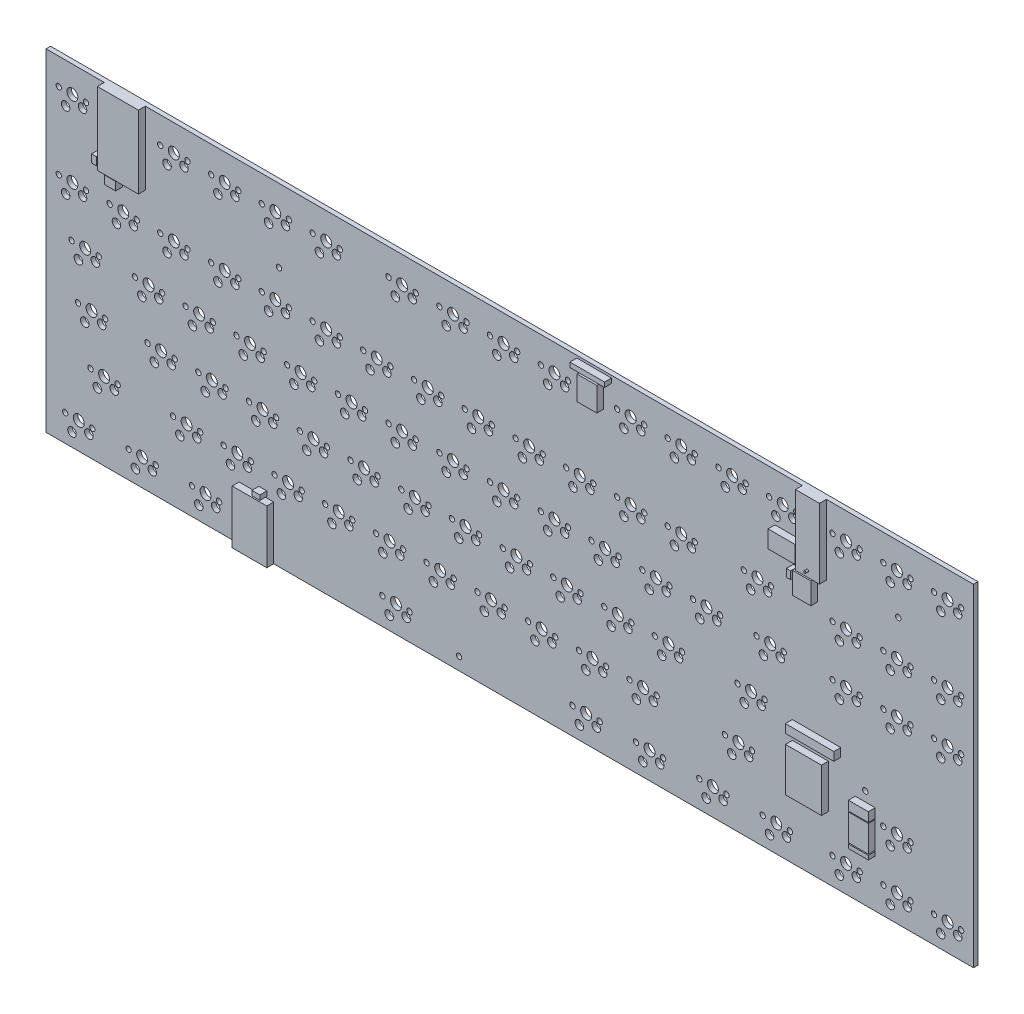
from build123d import *

# Parameters (mm, degrees)
SKETCH_1_W          = 348.235
SKETCH_1_H          = 124.714
EXTRUDE_1_DEPTH     = 1.7
SKETCH_3_R          = 1
CUT_EXTRUDE_1_DEPTH = 370.897400668
SKETCH_4_R          = 2.05
SKETCH_4_R_2        = 1.6
CUT_EXTRUDE_2_DEPTH = 370.897400668
SKETCH_5_R          = 2.05
SKETCH_5_R_2        = 1.6
SKETCH_5_R_3        = 1
CUT_EXTRUDE_3_DEPTH = 370.897400668
SKETCH_6_R          = 2.05
SKETCH_6_R_2        = 1.6
SKETCH_6_R_3        = 1
CUT_EXTRUDE_4_DEPTH = 370.897400668
SKETCH_8_R          = 2.05
SKETCH_8_R_2        = 1.6
SKETCH_8_R_3        = 1
CUT_EXTRUDE_5_DEPTH = 370.897400668
SKETCH_10_R         = 2.05
SKETCH_10_R_2       = 1.6
SKETCH_10_R_3       = 1
CUT_EXTRUDE_6_DEPTH = 370.897400668
SKETCH_11_R         = 1
CUT_EXTRUDE_7_DEPTH = 370.897400668
SKETCH_12_W         = 15.4
SKETCH_12_H         = 27.3
SKETCH_12_W_2       = 1.8
SKETCH_12_H_2       = 3
SKETCH_12_W_3       = 4.1
SKETCH_12_H_3       = 3.1
SKETCH_12_W_4       = 13
SKETCH_12_H_4       = 1.8
SKETCH_12_W_5       = 7.4
SKETCH_12_H_5       = 9
SKETCH_12_W_6       = 9
SKETCH_12_H_6       = 26.3
SKETCH_12_W_7       = 10.1
SKETCH_12_H_7       = 6.5
SKETCH_12_W_8       = 6.9
SKETCH_12_H_8       = 8.1
SKETCH_12_W_9       = 1.6
SKETCH_12_H_9       = 2.9
SKETCH_12_W_10      = 18.2
SKETCH_12_H_10      = 3.2
SKETCH_12_W_11      = 13.5
SKETCH_12_H_11      = 16.4
SKETCH_12_W_12      = 7.5
SKETCH_12_H_12      = 10
SKETCH_12_H_13      = 3.5
SKETCH_12_H_14      = 1.5
SKETCH_12_H_15      = 20.1
SKETCH_12_W_13      = 3
EXTRUDE_2_DEPTH     = 2.6
SKETCH_13_W         = 6.6
SKETCH_13_H         = 11.2
EXTRUDE_3_DEPTH     = 2
SKETCH_15_R         = 0.4
EXTRUDE_4_DEPTH     = 1


with BuildPart() as part:
    # 草图1 → 凸台-拉伸1 (new body)
    with BuildSketch(Plane.XY):
        with Locations((174.1175, -62.357)):
            Rectangle(SKETCH_1_W, SKETCH_1_H)
    extrude(amount=EXTRUDE_1_DEPTH)

    # 草图3 → 切除-拉伸1 (cut, through all)
    with BuildSketch(Plane.XY.offset(1.7)):
        with Locations((87.5, -27.4)):
            Circle(SKETCH_3_R)
        with Locations((155.1, -120)):
            Circle(SKETCH_3_R)
        with Locations((307.6, -87.5)):
            Circle(SKETCH_3_R)
        with Locations((320, -24.9)):
            Circle(SKETCH_3_R)
    extrude(amount=-CUT_EXTRUDE_1_DEPTH, mode=Mode.SUBTRACT)

    # 草图4 → 切除-拉伸2 (cut, through all)
    with BuildSketch(Plane.XY.offset(1.7)):
        with Locations((9.9, -9.9)):
            Circle(SKETCH_4_R)
        with Locations((7.36, -14.91)):
            Circle(SKETCH_4_R_2)
        with Locations((13.71, -12.44)):
            Circle(SKETCH_4_R_2)
        with Locations((9.9, -38.5)):
            Circle(SKETCH_4_R)
        with Locations((7.36, -43.51)):
            Circle(SKETCH_4_R_2)
        with Locations((13.71, -41.04)):
            Circle(SKETCH_4_R_2)
        with Locations((14.7, -57.5)):
            Circle(SKETCH_4_R)
        with Locations((12.16, -62.51)):
            Circle(SKETCH_4_R_2)
        with Locations((18.51, -60.04)):
            Circle(SKETCH_4_R_2)
        with Locations((17.1, -76.6)):
            Circle(SKETCH_4_R)
        with Locations((14.56, -81.61)):
            Circle(SKETCH_4_R_2)
        with Locations((20.91, -79.14)):
            Circle(SKETCH_4_R_2)
        with Locations((21.8, -95.6)):
            Circle(SKETCH_4_R)
        with Locations((19.26, -100.61)):
            Circle(SKETCH_4_R_2)
        with Locations((25.61, -98.14)):
            Circle(SKETCH_4_R_2)
        with Locations((12.3, -114.7)):
            Circle(SKETCH_4_R)
        with Locations((9.76, -119.71)):
            Circle(SKETCH_4_R_2)
        with Locations((16.11, -117.24)):
            Circle(SKETCH_4_R_2)
        with Locations((48, -9.9)):
            Circle(SKETCH_4_R)
        with Locations((45.46, -14.91)):
            Circle(SKETCH_4_R_2)
        with Locations((51.81, -12.44)):
            Circle(SKETCH_4_R_2)
        with Locations((105.2, -9.9)):
            Circle(SKETCH_4_R)
        with Locations((102.66, -14.91)):
            Circle(SKETCH_4_R_2)
        with Locations((109.01, -12.44)):
            Circle(SKETCH_4_R_2)
        with Locations((133.7, -9.9)):
            Circle(SKETCH_4_R)
        with Locations((131.16, -14.91)):
            Circle(SKETCH_4_R_2)
        with Locations((137.51, -12.44)):
            Circle(SKETCH_4_R_2)
        with Locations((190.9, -9.9)):
            Circle(SKETCH_4_R)
        with Locations((188.36, -14.91)):
            Circle(SKETCH_4_R_2)
        with Locations((194.71, -12.44)):
            Circle(SKETCH_4_R_2)
        with Locations((219.5, -9.9)):
            Circle(SKETCH_4_R)
        with Locations((216.96, -14.91)):
            Circle(SKETCH_4_R_2)
        with Locations((223.31, -12.44)):
            Circle(SKETCH_4_R_2)
        with Locations((276.6, -9.9)):
            Circle(SKETCH_4_R)
        with Locations((274.06, -14.91)):
            Circle(SKETCH_4_R_2)
        with Locations((280.41, -12.44)):
            Circle(SKETCH_4_R_2)
        with Locations((300.4, -9.9)):
            Circle(SKETCH_4_R)
        with Locations((297.86, -14.91)):
            Circle(SKETCH_4_R_2)
        with Locations((304.21, -12.44)):
            Circle(SKETCH_4_R_2)
        with Locations((338.5, -9.9)):
            Circle(SKETCH_4_R)
        with Locations((335.96, -14.91)):
            Circle(SKETCH_4_R_2)
        with Locations((342.31, -12.44)):
            Circle(SKETCH_4_R_2)
        with Locations((260, -95.6)):
            Circle(SKETCH_4_R)
        with Locations((257.46, -100.61)):
            Circle(SKETCH_4_R_2)
        with Locations((263.81, -98.14)):
            Circle(SKETCH_4_R_2)
        with Locations((264.7, -76.6)):
            Circle(SKETCH_4_R)
        with Locations((262.16, -81.61)):
            Circle(SKETCH_4_R_2)
        with Locations((268.51, -79.14)):
            Circle(SKETCH_4_R_2)
        with Locations((271.9, -57.5)):
            Circle(SKETCH_4_R)
        with Locations((269.36, -62.51)):
            Circle(SKETCH_4_R_2)
        with Locations((275.71, -60.04)):
            Circle(SKETCH_4_R_2)
        with Locations((267.1, -38.5)):
            Circle(SKETCH_4_R)
        with Locations((264.56, -43.51)):
            Circle(SKETCH_4_R_2)
        with Locations((270.91, -41.04)):
            Circle(SKETCH_4_R_2)
        with Locations((274.2, -114.7)):
            Circle(SKETCH_4_R)
        with Locations((271.66, -119.71)):
            Circle(SKETCH_4_R_2)
        with Locations((278.01, -117.24)):
            Circle(SKETCH_4_R_2)
        with Locations((300.4, -38.5)):
            Circle(SKETCH_4_R)
        with Locations((297.86, -43.51)):
            Circle(SKETCH_4_R_2)
        with Locations((304.21, -41.04)):
            Circle(SKETCH_4_R_2)
        with Locations((338.5, -38.5)):
            Circle(SKETCH_4_R)
        with Locations((335.96, -43.51)):
            Circle(SKETCH_4_R_2)
        with Locations((342.31, -41.04)):
            Circle(SKETCH_4_R_2)
        with Locations((300.4, -57.5)):
            Circle(SKETCH_4_R)
        with Locations((297.86, -62.51)):
            Circle(SKETCH_4_R_2)
        with Locations((304.21, -60.04)):
            Circle(SKETCH_4_R_2)
        with Locations((338.5, -57.5)):
            Circle(SKETCH_4_R)
        with Locations((335.96, -62.51)):
            Circle(SKETCH_4_R_2)
        with Locations((342.31, -60.04)):
            Circle(SKETCH_4_R_2)
        with Locations((300.4, -114.7)):
            Circle(SKETCH_4_R)
        with Locations((297.86, -119.71)):
            Circle(SKETCH_4_R_2)
        with Locations((304.21, -117.24)):
            Circle(SKETCH_4_R_2)
        with Locations((319.5, -114.7)):
            Circle(SKETCH_4_R)
        with Locations((316.96, -119.71)):
            Circle(SKETCH_4_R_2)
        with Locations((323.31, -117.24)):
            Circle(SKETCH_4_R_2)
        with Locations((338.5, -114.7)):
            Circle(SKETCH_4_R)
        with Locations((335.96, -119.71)):
            Circle(SKETCH_4_R_2)
        with Locations((342.31, -117.24)):
            Circle(SKETCH_4_R_2)
        with Locations((319.5, -95.6)):
            Circle(SKETCH_4_R)
        with Locations((316.96, -100.61)):
            Circle(SKETCH_4_R_2)
        with Locations((323.31, -98.14)):
            Circle(SKETCH_4_R_2)
        with Locations((319.5, -57.5)):
            Circle(SKETCH_4_R)
        with Locations((316.96, -62.51)):
            Circle(SKETCH_4_R_2)
        with Locations((323.31, -60.04)):
            Circle(SKETCH_4_R_2)
        with Locations((319.5, -38.5)):
            Circle(SKETCH_4_R)
        with Locations((316.96, -43.51)):
            Circle(SKETCH_4_R_2)
        with Locations((323.31, -41.04)):
            Circle(SKETCH_4_R_2)
        with Locations((319.5, -9.9)):
            Circle(SKETCH_4_R)
        with Locations((316.96, -14.91)):
            Circle(SKETCH_4_R_2)
        with Locations((323.31, -12.44)):
            Circle(SKETCH_4_R_2)
        with Locations((131.4, -114.7)):
            Circle(SKETCH_4_R)
        with Locations((128.86, -119.71)):
            Circle(SKETCH_4_R_2)
        with Locations((135.21, -117.24)):
            Circle(SKETCH_4_R_2)
        with Locations((67.1, -9.9)):
            Circle(SKETCH_4_R)
        with Locations((64.56, -14.91)):
            Circle(SKETCH_4_R_2)
        with Locations((70.91, -12.44)):
            Circle(SKETCH_4_R_2)
        with Locations((86.1, -9.9)):
            Circle(SKETCH_4_R)
        with Locations((83.56, -14.91)):
            Circle(SKETCH_4_R_2)
        with Locations((89.91, -12.44)):
            Circle(SKETCH_4_R_2)
        with Locations((152.8, -9.9)):
            Circle(SKETCH_4_R)
        with Locations((150.26, -14.91)):
            Circle(SKETCH_4_R_2)
        with Locations((156.61, -12.44)):
            Circle(SKETCH_4_R_2)
        with Locations((171.8, -9.9)):
            Circle(SKETCH_4_R)
        with Locations((169.26, -14.91)):
            Circle(SKETCH_4_R_2)
        with Locations((175.61, -12.44)):
            Circle(SKETCH_4_R_2)
        with Locations((238.5, -9.9)):
            Circle(SKETCH_4_R)
        with Locations((235.96, -14.91)):
            Circle(SKETCH_4_R_2)
        with Locations((242.31, -12.44)):
            Circle(SKETCH_4_R_2)
        with Locations((257.6, -9.9)):
            Circle(SKETCH_4_R)
        with Locations((255.06, -14.91)):
            Circle(SKETCH_4_R_2)
        with Locations((261.41, -12.44)):
            Circle(SKETCH_4_R_2)
    extrude(amount=-CUT_EXTRUDE_2_DEPTH, mode=Mode.SUBTRACT)

    # 草图5 → 切除-拉伸3 (cut, through all)
    with BuildSketch(Plane.XY.offset(1.7)):
        with Locations((29, -38.5)):
            Circle(SKETCH_5_R)
        with Locations((26.46, -43.51)):
            Circle(SKETCH_5_R_2)
        with Locations((32.81, -41.04)):
            Circle(SKETCH_5_R_2)
        with Locations((48, -38.5)):
            Circle(SKETCH_5_R)
        with Locations((45.46, -43.51)):
            Circle(SKETCH_5_R_2)
        with Locations((51.81, -41.04)):
            Circle(SKETCH_5_R_2)
        with Locations((67.1, -38.5)):
            Circle(SKETCH_5_R)
        with Locations((64.56, -43.51)):
            Circle(SKETCH_5_R_2)
        with Locations((70.91, -41.04)):
            Circle(SKETCH_5_R_2)
        with Locations((86.1, -38.5)):
            Circle(SKETCH_5_R)
        with Locations((83.56, -43.51)):
            Circle(SKETCH_5_R_2)
        with Locations((89.91, -41.04)):
            Circle(SKETCH_5_R_2)
        with Locations((105.2, -38.5)):
            Circle(SKETCH_5_R)
        with Locations((102.66, -43.51)):
            Circle(SKETCH_5_R_2)
        with Locations((109.01, -41.04)):
            Circle(SKETCH_5_R_2)
        with Locations((124.2, -38.5)):
            Circle(SKETCH_5_R)
        with Locations((121.66, -43.51)):
            Circle(SKETCH_5_R_2)
        with Locations((128.01, -41.04)):
            Circle(SKETCH_5_R_2)
        with Locations((143.3, -38.5)):
            Circle(SKETCH_5_R)
        with Locations((140.76, -43.51)):
            Circle(SKETCH_5_R_2)
        with Locations((147.11, -41.04)):
            Circle(SKETCH_5_R_2)
        with Locations((162.3, -38.5)):
            Circle(SKETCH_5_R)
        with Locations((159.76, -43.51)):
            Circle(SKETCH_5_R_2)
        with Locations((166.11, -41.04)):
            Circle(SKETCH_5_R_2)
        with Locations((181.4, -38.5)):
            Circle(SKETCH_5_R)
        with Locations((178.86, -43.51)):
            Circle(SKETCH_5_R_2)
        with Locations((185.21, -41.04)):
            Circle(SKETCH_5_R_2)
        with Locations((200.4, -38.5)):
            Circle(SKETCH_5_R)
        with Locations((197.86, -43.51)):
            Circle(SKETCH_5_R_2)
        with Locations((204.21, -41.04)):
            Circle(SKETCH_5_R_2)
        with Locations((219.5, -38.5)):
            Circle(SKETCH_5_R)
        with Locations((216.96, -43.51)):
            Circle(SKETCH_5_R_2)
        with Locations((223.31, -41.04)):
            Circle(SKETCH_5_R_2)
        with Locations((238.5, -38.5)):
            Circle(SKETCH_5_R)
        with Locations((235.96, -43.51)):
            Circle(SKETCH_5_R_2)
        with Locations((242.31, -41.04)):
            Circle(SKETCH_5_R_2)
        with Locations((23.9, -38.5)):
            Circle(SKETCH_5_R_3)
        with Locations((34.1, -38.5)):
            Circle(SKETCH_5_R_3)
        with Locations((42.9, -38.5)):
            Circle(SKETCH_5_R_3)
        with Locations((53.1, -38.5)):
            Circle(SKETCH_5_R_3)
        with Locations((62, -38.5)):
            Circle(SKETCH_5_R_3)
        with Locations((72.2, -38.5)):
            Circle(SKETCH_5_R_3)
        with Locations((81, -38.5)):
            Circle(SKETCH_5_R_3)
        with Locations((91.2, -38.5)):
            Circle(SKETCH_5_R_3)
        with Locations((100.1, -38.5)):
            Circle(SKETCH_5_R_3)
        with Locations((110.3, -38.5)):
            Circle(SKETCH_5_R_3)
        with Locations((119.1, -38.5)):
            Circle(SKETCH_5_R_3)
        with Locations((129.3, -38.5)):
            Circle(SKETCH_5_R_3)
        with Locations((138.2, -38.5)):
            Circle(SKETCH_5_R_3)
        with Locations((148.4, -38.5)):
            Circle(SKETCH_5_R_3)
        with Locations((157.2, -38.5)):
            Circle(SKETCH_5_R_3)
        with Locations((167.4, -38.5)):
            Circle(SKETCH_5_R_3)
        with Locations((176.3, -38.5)):
            Circle(SKETCH_5_R_3)
        with Locations((186.5, -38.5)):
            Circle(SKETCH_5_R_3)
        with Locations((195.3, -38.5)):
            Circle(SKETCH_5_R_3)
        with Locations((205.5, -38.5)):
            Circle(SKETCH_5_R_3)
        with Locations((214.4, -38.5)):
            Circle(SKETCH_5_R_3)
        with Locations((224.6, -38.5)):
            Circle(SKETCH_5_R_3)
        with Locations((233.4, -38.5)):
            Circle(SKETCH_5_R_3)
        with Locations((243.6, -38.5)):
            Circle(SKETCH_5_R_3)
    extrude(amount=-CUT_EXTRUDE_3_DEPTH, mode=Mode.SUBTRACT)

    # 草图6 → 切除-拉伸4 (cut, through all)
    with BuildSketch(Plane.XY.offset(1.7)):
        with Locations((38.5, -57.5)):
            Circle(SKETCH_6_R)
        with Locations((35.96, -62.51)):
            Circle(SKETCH_6_R_2)
        with Locations((42.31, -60.04)):
            Circle(SKETCH_6_R_2)
        with Locations((33.4, -57.5)):
            Circle(SKETCH_6_R_3)
        with Locations((43.6, -57.5)):
            Circle(SKETCH_6_R_3)
        with Locations((57.5, -57.5)):
            Circle(SKETCH_6_R)
        with Locations((54.96, -62.51)):
            Circle(SKETCH_6_R_2)
        with Locations((61.31, -60.04)):
            Circle(SKETCH_6_R_2)
        with Locations((52.4, -57.5)):
            Circle(SKETCH_6_R_3)
        with Locations((62.6, -57.5)):
            Circle(SKETCH_6_R_3)
        with Locations((76.6, -57.5)):
            Circle(SKETCH_6_R)
        with Locations((74.06, -62.51)):
            Circle(SKETCH_6_R_2)
        with Locations((80.41, -60.04)):
            Circle(SKETCH_6_R_2)
        with Locations((71.5, -57.5)):
            Circle(SKETCH_6_R_3)
        with Locations((81.7, -57.5)):
            Circle(SKETCH_6_R_3)
        with Locations((95.6, -57.5)):
            Circle(SKETCH_6_R)
        with Locations((93.06, -62.51)):
            Circle(SKETCH_6_R_2)
        with Locations((99.41, -60.04)):
            Circle(SKETCH_6_R_2)
        with Locations((90.5, -57.5)):
            Circle(SKETCH_6_R_3)
        with Locations((100.7, -57.5)):
            Circle(SKETCH_6_R_3)
        with Locations((114.7, -57.5)):
            Circle(SKETCH_6_R)
        with Locations((112.16, -62.51)):
            Circle(SKETCH_6_R_2)
        with Locations((118.51, -60.04)):
            Circle(SKETCH_6_R_2)
        with Locations((109.6, -57.5)):
            Circle(SKETCH_6_R_3)
        with Locations((119.8, -57.5)):
            Circle(SKETCH_6_R_3)
        with Locations((133.7, -57.5)):
            Circle(SKETCH_6_R)
        with Locations((131.16, -62.51)):
            Circle(SKETCH_6_R_2)
        with Locations((137.51, -60.04)):
            Circle(SKETCH_6_R_2)
        with Locations((128.6, -57.5)):
            Circle(SKETCH_6_R_3)
        with Locations((138.8, -57.5)):
            Circle(SKETCH_6_R_3)
        with Locations((152.8, -57.5)):
            Circle(SKETCH_6_R)
        with Locations((150.26, -62.51)):
            Circle(SKETCH_6_R_2)
        with Locations((156.61, -60.04)):
            Circle(SKETCH_6_R_2)
        with Locations((147.7, -57.5)):
            Circle(SKETCH_6_R_3)
        with Locations((157.9, -57.5)):
            Circle(SKETCH_6_R_3)
        with Locations((171.8, -57.5)):
            Circle(SKETCH_6_R)
        with Locations((169.26, -62.51)):
            Circle(SKETCH_6_R_2)
        with Locations((175.61, -60.04)):
            Circle(SKETCH_6_R_2)
        with Locations((166.7, -57.5)):
            Circle(SKETCH_6_R_3)
        with Locations((176.9, -57.5)):
            Circle(SKETCH_6_R_3)
        with Locations((190.9, -57.5)):
            Circle(SKETCH_6_R)
        with Locations((188.36, -62.51)):
            Circle(SKETCH_6_R_2)
        with Locations((194.71, -60.04)):
            Circle(SKETCH_6_R_2)
        with Locations((185.8, -57.5)):
            Circle(SKETCH_6_R_3)
        with Locations((196, -57.5)):
            Circle(SKETCH_6_R_3)
        with Locations((209.9, -57.5)):
            Circle(SKETCH_6_R)
        with Locations((207.36, -62.51)):
            Circle(SKETCH_6_R_2)
        with Locations((213.71, -60.04)):
            Circle(SKETCH_6_R_2)
        with Locations((204.8, -57.5)):
            Circle(SKETCH_6_R_3)
        with Locations((215, -57.5)):
            Circle(SKETCH_6_R_3)
        with Locations((229, -57.5)):
            Circle(SKETCH_6_R)
        with Locations((226.46, -62.51)):
            Circle(SKETCH_6_R_2)
        with Locations((232.81, -60.04)):
            Circle(SKETCH_6_R_2)
        with Locations((223.9, -57.5)):
            Circle(SKETCH_6_R_3)
        with Locations((234.1, -57.5)):
            Circle(SKETCH_6_R_3)
        with Locations((248, -57.5)):
            Circle(SKETCH_6_R)
        with Locations((245.46, -62.51)):
            Circle(SKETCH_6_R_2)
        with Locations((251.81, -60.04)):
            Circle(SKETCH_6_R_2)
        with Locations((242.9, -57.5)):
            Circle(SKETCH_6_R_3)
        with Locations((253.1, -57.5)):
            Circle(SKETCH_6_R_3)
    extrude(amount=-CUT_EXTRUDE_4_DEPTH, mode=Mode.SUBTRACT)

    # 草图8 → 切除-拉伸5 (cut, through all)
    with BuildSketch(Plane.XY.offset(1.7)):
        with Locations((43.2, -76.6)):
            Circle(SKETCH_8_R)
        with Locations((40.66, -81.61)):
            Circle(SKETCH_8_R_2)
        with Locations((47.01, -79.14)):
            Circle(SKETCH_8_R_2)
        with Locations((38.1, -76.6)):
            Circle(SKETCH_8_R_3)
        with Locations((48.3, -76.6)):
            Circle(SKETCH_8_R_3)
        with Locations((62.3, -76.6)):
            Circle(SKETCH_8_R)
        with Locations((59.76, -81.61)):
            Circle(SKETCH_8_R_2)
        with Locations((66.11, -79.14)):
            Circle(SKETCH_8_R_2)
        with Locations((57.2, -76.6)):
            Circle(SKETCH_8_R_3)
        with Locations((67.4, -76.6)):
            Circle(SKETCH_8_R_3)
        with Locations((81.3, -76.6)):
            Circle(SKETCH_8_R)
        with Locations((78.76, -81.61)):
            Circle(SKETCH_8_R_2)
        with Locations((85.11, -79.14)):
            Circle(SKETCH_8_R_2)
        with Locations((76.2, -76.6)):
            Circle(SKETCH_8_R_3)
        with Locations((86.4, -76.6)):
            Circle(SKETCH_8_R_3)
        with Locations((100.4, -76.6)):
            Circle(SKETCH_8_R)
        with Locations((97.86, -81.61)):
            Circle(SKETCH_8_R_2)
        with Locations((104.21, -79.14)):
            Circle(SKETCH_8_R_2)
        with Locations((95.3, -76.6)):
            Circle(SKETCH_8_R_3)
        with Locations((105.5, -76.6)):
            Circle(SKETCH_8_R_3)
        with Locations((119.4, -76.6)):
            Circle(SKETCH_8_R)
        with Locations((116.86, -81.61)):
            Circle(SKETCH_8_R_2)
        with Locations((123.21, -79.14)):
            Circle(SKETCH_8_R_2)
        with Locations((114.3, -76.6)):
            Circle(SKETCH_8_R_3)
        with Locations((124.5, -76.6)):
            Circle(SKETCH_8_R_3)
        with Locations((138.5, -76.6)):
            Circle(SKETCH_8_R)
        with Locations((135.96, -81.61)):
            Circle(SKETCH_8_R_2)
        with Locations((142.31, -79.14)):
            Circle(SKETCH_8_R_2)
        with Locations((133.4, -76.6)):
            Circle(SKETCH_8_R_3)
        with Locations((143.6, -76.6)):
            Circle(SKETCH_8_R_3)
        with Locations((157.5, -76.6)):
            Circle(SKETCH_8_R)
        with Locations((154.96, -81.61)):
            Circle(SKETCH_8_R_2)
        with Locations((161.31, -79.14)):
            Circle(SKETCH_8_R_2)
        with Locations((152.4, -76.6)):
            Circle(SKETCH_8_R_3)
        with Locations((162.6, -76.6)):
            Circle(SKETCH_8_R_3)
        with Locations((176.6, -76.6)):
            Circle(SKETCH_8_R)
        with Locations((174.06, -81.61)):
            Circle(SKETCH_8_R_2)
        with Locations((180.41, -79.14)):
            Circle(SKETCH_8_R_2)
        with Locations((171.5, -76.6)):
            Circle(SKETCH_8_R_3)
        with Locations((181.7, -76.6)):
            Circle(SKETCH_8_R_3)
        with Locations((195.6, -76.6)):
            Circle(SKETCH_8_R)
        with Locations((193.06, -81.61)):
            Circle(SKETCH_8_R_2)
        with Locations((199.41, -79.14)):
            Circle(SKETCH_8_R_2)
        with Locations((190.5, -76.6)):
            Circle(SKETCH_8_R_3)
        with Locations((200.7, -76.6)):
            Circle(SKETCH_8_R_3)
        with Locations((214.7, -76.6)):
            Circle(SKETCH_8_R)
        with Locations((212.16, -81.61)):
            Circle(SKETCH_8_R_2)
        with Locations((218.51, -79.14)):
            Circle(SKETCH_8_R_2)
        with Locations((209.6, -76.6)):
            Circle(SKETCH_8_R_3)
        with Locations((219.8, -76.6)):
            Circle(SKETCH_8_R_3)
        with Locations((233.7, -76.6)):
            Circle(SKETCH_8_R)
        with Locations((231.16, -81.61)):
            Circle(SKETCH_8_R_2)
        with Locations((237.51, -79.14)):
            Circle(SKETCH_8_R_2)
        with Locations((228.6, -76.6)):
            Circle(SKETCH_8_R_3)
        with Locations((238.8, -76.6)):
            Circle(SKETCH_8_R_3)
    extrude(amount=-CUT_EXTRUDE_5_DEPTH, mode=Mode.SUBTRACT)

    # 草图10 → 切除-拉伸6 (cut, through all)
    with BuildSketch(Plane.XY.offset(1.7)):
        with Locations((52.8, -95.6)):
            Circle(SKETCH_10_R)
        with Locations((50.26, -100.61)):
            Circle(SKETCH_10_R_2)
        with Locations((56.61, -98.14)):
            Circle(SKETCH_10_R_2)
        with Locations((47.7, -95.6)):
            Circle(SKETCH_10_R_3)
        with Locations((57.9, -95.6)):
            Circle(SKETCH_10_R_3)
        with Locations((71.8, -95.6)):
            Circle(SKETCH_10_R)
        with Locations((69.26, -100.61)):
            Circle(SKETCH_10_R_2)
        with Locations((75.61, -98.14)):
            Circle(SKETCH_10_R_2)
        with Locations((66.7, -95.6)):
            Circle(SKETCH_10_R_3)
        with Locations((76.9, -95.6)):
            Circle(SKETCH_10_R_3)
        with Locations((90.9, -95.6)):
            Circle(SKETCH_10_R)
        with Locations((88.36, -100.61)):
            Circle(SKETCH_10_R_2)
        with Locations((94.71, -98.14)):
            Circle(SKETCH_10_R_2)
        with Locations((85.8, -95.6)):
            Circle(SKETCH_10_R_3)
        with Locations((96, -95.6)):
            Circle(SKETCH_10_R_3)
        with Locations((109.9, -95.6)):
            Circle(SKETCH_10_R)
        with Locations((107.36, -100.61)):
            Circle(SKETCH_10_R_2)
        with Locations((113.71, -98.14)):
            Circle(SKETCH_10_R_2)
        with Locations((104.8, -95.6)):
            Circle(SKETCH_10_R_3)
        with Locations((115, -95.6)):
            Circle(SKETCH_10_R_3)
        with Locations((129, -95.6)):
            Circle(SKETCH_10_R)
        with Locations((126.46, -100.61)):
            Circle(SKETCH_10_R_2)
        with Locations((132.81, -98.14)):
            Circle(SKETCH_10_R_2)
        with Locations((123.9, -95.6)):
            Circle(SKETCH_10_R_3)
        with Locations((134.1, -95.6)):
            Circle(SKETCH_10_R_3)
        with Locations((148, -95.6)):
            Circle(SKETCH_10_R)
        with Locations((145.46, -100.61)):
            Circle(SKETCH_10_R_2)
        with Locations((151.81, -98.14)):
            Circle(SKETCH_10_R_2)
        with Locations((142.9, -95.6)):
            Circle(SKETCH_10_R_3)
        with Locations((153.1, -95.6)):
            Circle(SKETCH_10_R_3)
        with Locations((167.1, -95.6)):
            Circle(SKETCH_10_R)
        with Locations((164.56, -100.61)):
            Circle(SKETCH_10_R_2)
        with Locations((170.91, -98.14)):
            Circle(SKETCH_10_R_2)
        with Locations((162, -95.6)):
            Circle(SKETCH_10_R_3)
        with Locations((172.2, -95.6)):
            Circle(SKETCH_10_R_3)
        with Locations((186.1, -95.6)):
            Circle(SKETCH_10_R)
        with Locations((183.56, -100.61)):
            Circle(SKETCH_10_R_2)
        with Locations((189.91, -98.14)):
            Circle(SKETCH_10_R_2)
        with Locations((181, -95.6)):
            Circle(SKETCH_10_R_3)
        with Locations((191.2, -95.6)):
            Circle(SKETCH_10_R_3)
        with Locations((205.2, -95.6)):
            Circle(SKETCH_10_R)
        with Locations((202.66, -100.61)):
            Circle(SKETCH_10_R_2)
        with Locations((209.01, -98.14)):
            Circle(SKETCH_10_R_2)
        with Locations((200.1, -95.6)):
            Circle(SKETCH_10_R_3)
        with Locations((210.3, -95.6)):
            Circle(SKETCH_10_R_3)
        with Locations((224.2, -95.6)):
            Circle(SKETCH_10_R)
        with Locations((221.66, -100.61)):
            Circle(SKETCH_10_R_2)
        with Locations((228.01, -98.14)):
            Circle(SKETCH_10_R_2)
        with Locations((219.1, -95.6)):
            Circle(SKETCH_10_R_3)
        with Locations((229.3, -95.6)):
            Circle(SKETCH_10_R_3)
        with Locations((36.1, -114.7)):
            Circle(SKETCH_10_R)
        with Locations((33.56, -119.71)):
            Circle(SKETCH_10_R_2)
        with Locations((39.91, -117.24)):
            Circle(SKETCH_10_R_2)
        with Locations((31, -114.7)):
            Circle(SKETCH_10_R_3)
        with Locations((41.2, -114.7)):
            Circle(SKETCH_10_R_3)
        with Locations((59.9, -114.7)):
            Circle(SKETCH_10_R)
        with Locations((57.36, -119.71)):
            Circle(SKETCH_10_R_2)
        with Locations((63.71, -117.24)):
            Circle(SKETCH_10_R_2)
        with Locations((54.8, -114.7)):
            Circle(SKETCH_10_R_3)
        with Locations((65, -114.7)):
            Circle(SKETCH_10_R_3)
        with Locations((202.8, -114.7)):
            Circle(SKETCH_10_R)
        with Locations((200.26, -119.71)):
            Circle(SKETCH_10_R_2)
        with Locations((206.61, -117.24)):
            Circle(SKETCH_10_R_2)
        with Locations((197.7, -114.7)):
            Circle(SKETCH_10_R_3)
        with Locations((207.9, -114.7)):
            Circle(SKETCH_10_R_3)
        with Locations((226.6, -114.7)):
            Circle(SKETCH_10_R)
        with Locations((224.06, -119.71)):
            Circle(SKETCH_10_R_2)
        with Locations((230.41, -117.24)):
            Circle(SKETCH_10_R_2)
        with Locations((221.5, -114.7)):
            Circle(SKETCH_10_R_3)
        with Locations((231.7, -114.7)):
            Circle(SKETCH_10_R_3)
        with Locations((250.4, -114.7)):
            Circle(SKETCH_10_R)
        with Locations((247.86, -119.71)):
            Circle(SKETCH_10_R_2)
        with Locations((254.21, -117.24)):
            Circle(SKETCH_10_R_2)
        with Locations((245.3, -114.7)):
            Circle(SKETCH_10_R_3)
        with Locations((255.5, -114.7)):
            Circle(SKETCH_10_R_3)
    extrude(amount=-CUT_EXTRUDE_6_DEPTH, mode=Mode.SUBTRACT)

    # 草图11 → 切除-拉伸7 (cut, through all)
    with BuildSketch(Plane.XY.offset(1.7)):
        with Locations((4.8, -9.9)):
            Circle(SKETCH_11_R)
        with Locations((15, -9.9)):
            Circle(SKETCH_11_R)
        with Locations((42.9, -9.9)):
            Circle(SKETCH_11_R)
        with Locations((53.1, -9.9)):
            Circle(SKETCH_11_R)
        with Locations((62, -9.9)):
            Circle(SKETCH_11_R)
        with Locations((72.2, -9.9)):
            Circle(SKETCH_11_R)
        with Locations((81, -9.9)):
            Circle(SKETCH_11_R)
        with Locations((91.2, -9.9)):
            Circle(SKETCH_11_R)
        with Locations((100.1, -9.9)):
            Circle(SKETCH_11_R)
        with Locations((110.3, -9.9)):
            Circle(SKETCH_11_R)
        with Locations((128.6, -9.9)):
            Circle(SKETCH_11_R)
        with Locations((138.8, -9.9)):
            Circle(SKETCH_11_R)
        with Locations((147.7, -9.9)):
            Circle(SKETCH_11_R)
        with Locations((157.9, -9.9)):
            Circle(SKETCH_11_R)
        with Locations((166.7, -9.9)):
            Circle(SKETCH_11_R)
        with Locations((176.9, -9.9)):
            Circle(SKETCH_11_R)
        with Locations((185.8, -9.9)):
            Circle(SKETCH_11_R)
        with Locations((196, -9.9)):
            Circle(SKETCH_11_R)
        with Locations((214.4, -9.9)):
            Circle(SKETCH_11_R)
        with Locations((224.6, -9.9)):
            Circle(SKETCH_11_R)
        with Locations((233.4, -9.9)):
            Circle(SKETCH_11_R)
        with Locations((243.6, -9.9)):
            Circle(SKETCH_11_R)
        with Locations((252.5, -9.9)):
            Circle(SKETCH_11_R)
        with Locations((262.7, -9.9)):
            Circle(SKETCH_11_R)
        with Locations((271.5, -9.9)):
            Circle(SKETCH_11_R)
        with Locations((281.7, -9.9)):
            Circle(SKETCH_11_R)
        with Locations((295.3, -9.9)):
            Circle(SKETCH_11_R)
        with Locations((305.5, -9.9)):
            Circle(SKETCH_11_R)
        with Locations((314.4, -9.9)):
            Circle(SKETCH_11_R)
        with Locations((324.6, -9.9)):
            Circle(SKETCH_11_R)
        with Locations((333.4, -9.9)):
            Circle(SKETCH_11_R)
        with Locations((343.6, -9.9)):
            Circle(SKETCH_11_R)
        with Locations((295.3, -38.5)):
            Circle(SKETCH_11_R)
        with Locations((305.5, -38.5)):
            Circle(SKETCH_11_R)
        with Locations((314.4, -38.5)):
            Circle(SKETCH_11_R)
        with Locations((324.6, -38.5)):
            Circle(SKETCH_11_R)
        with Locations((333.4, -38.5)):
            Circle(SKETCH_11_R)
        with Locations((343.6, -38.5)):
            Circle(SKETCH_11_R)
        with Locations((295.3, -57.5)):
            Circle(SKETCH_11_R)
        with Locations((305.5, -57.5)):
            Circle(SKETCH_11_R)
        with Locations((314.4, -57.5)):
            Circle(SKETCH_11_R)
        with Locations((324.6, -57.5)):
            Circle(SKETCH_11_R)
        with Locations((343.6, -57.5)):
            Circle(SKETCH_11_R)
        with Locations((262, -38.5)):
            Circle(SKETCH_11_R)
        with Locations((272.2, -38.5)):
            Circle(SKETCH_11_R)
        with Locations((266.8, -57.5)):
            Circle(SKETCH_11_R)
        with Locations((277, -57.5)):
            Circle(SKETCH_11_R)
        with Locations((259.6, -76.6)):
            Circle(SKETCH_11_R)
        with Locations((269.8, -76.6)):
            Circle(SKETCH_11_R)
        with Locations((254.9, -95.6)):
            Circle(SKETCH_11_R)
        with Locations((265.1, -95.6)):
            Circle(SKETCH_11_R)
        with Locations((314.4, -95.6)):
            Circle(SKETCH_11_R)
        with Locations((324.6, -95.6)):
            Circle(SKETCH_11_R)
        with Locations((269.1, -114.7)):
            Circle(SKETCH_11_R)
        with Locations((279.3, -114.7)):
            Circle(SKETCH_11_R)
        with Locations((295.3, -114.7)):
            Circle(SKETCH_11_R)
        with Locations((305.5, -114.7)):
            Circle(SKETCH_11_R)
        with Locations((314.4, -114.7)):
            Circle(SKETCH_11_R)
        with Locations((324.6, -114.7)):
            Circle(SKETCH_11_R)
        with Locations((333.4, -114.7)):
            Circle(SKETCH_11_R)
        with Locations((343.6, -114.7)):
            Circle(SKETCH_11_R)
        with Locations((333.4, -57.5)):
            Circle(SKETCH_11_R)
        with Locations((4.8, -38.5)):
            Circle(SKETCH_11_R)
        with Locations((15, -38.5)):
            Circle(SKETCH_11_R)
        with Locations((9.6, -57.5)):
            Circle(SKETCH_11_R)
        with Locations((19.8, -57.5)):
            Circle(SKETCH_11_R)
        with Locations((12, -76.6)):
            Circle(SKETCH_11_R)
        with Locations((22.2, -76.6)):
            Circle(SKETCH_11_R)
        with Locations((16.7, -95.6)):
            Circle(SKETCH_11_R)
        with Locations((26.9, -95.6)):
            Circle(SKETCH_11_R)
        with Locations((7.2, -114.7)):
            Circle(SKETCH_11_R)
        with Locations((17.4, -114.7)):
            Circle(SKETCH_11_R)
        with Locations((126.3, -114.7)):
            Circle(SKETCH_11_R)
        with Locations((136.5, -114.7)):
            Circle(SKETCH_11_R)
    extrude(amount=-CUT_EXTRUDE_7_DEPTH, mode=Mode.SUBTRACT)

    # 草图12 → 凸台-拉伸2 (add)
    with BuildSketch(Plane.XY.offset(1.7)):
        with Locations((29.6, -13.65)):
            Rectangle(SKETCH_12_W, SKETCH_12_H)
        with Locations((20.6, -24.5)):
            Rectangle(SKETCH_12_W_2, SKETCH_12_H_2)
        with Locations((26.7, -29)):
            Rectangle(SKETCH_12_W_3, SKETCH_12_H_3)
        with Locations((205.8, -1.8)):
            Rectangle(SKETCH_12_W_4, SKETCH_12_H_4)
        with Locations((205.7, -7.95)):
            Rectangle(SKETCH_12_W_5, SKETCH_12_H_5)
        with Locations((288.5, -13.15)):
            Rectangle(SKETCH_12_W_6, SKETCH_12_H_6)
        with Locations((278.75, -21.2)):
            Rectangle(SKETCH_12_W_7, SKETCH_12_H_7)
        with Locations((286.3, -30.9)):
            Rectangle(SKETCH_12_W_8, SKETCH_12_H_8)
        with Locations((281.4, -28.8)):
            Rectangle(SKETCH_12_W_9, SKETCH_12_H_9)
        with Locations((289.3, -79.6)):
            Rectangle(SKETCH_12_W_10, SKETCH_12_H_10)
        with Locations((287, -92.95)):
            Rectangle(SKETCH_12_W_11, SKETCH_12_H_11)
        with Locations((307.6, -99.9)):
            Rectangle(SKETCH_12_W_12, SKETCH_12_H_12)
        with Locations((307.6, -92.85)):
            Rectangle(SKETCH_12_W_12, SKETCH_12_H_13)
        with Locations((307.6, -106.05)):
            Rectangle(SKETCH_12_W_12, SKETCH_12_H_14)
        with Locations((79, -114.664)):
            Rectangle(SKETCH_12_W_4, SKETCH_12_H_15)
        with Locations((81.4, -103.214)):
            Rectangle(SKETCH_12_W_13, SKETCH_12_H_4)
    extrude(amount=EXTRUDE_2_DEPTH)

    # 草图13 → 凸台-拉伸3 (add)
    with BuildSketch(Plane(origin=(0, 0, 0), x_dir=(-1, 0, 0), z_dir=(0, 0, -1))):
        with Locations((-301.635, -86.1)):
            Rectangle(SKETCH_13_W, SKETCH_13_H)
    extrude(amount=EXTRUDE_3_DEPTH)

    # 草图15 → 凸台-拉伸4 (add)
    with BuildSketch(Plane.XY.offset(4.3)):
        with Locations((288.5, -24.1)):
            Circle(SKETCH_15_R)
    extrude(amount=EXTRUDE_4_DEPTH)


solid = part.part
